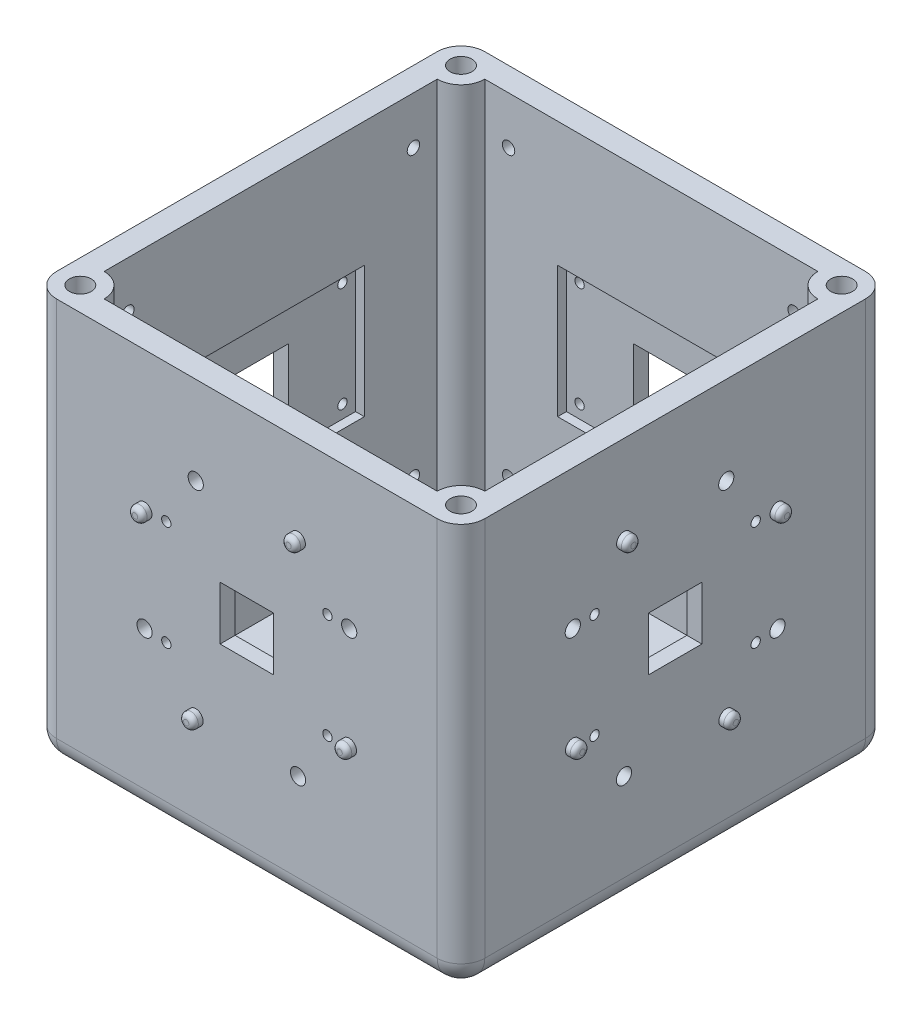
from build123d import *

# Parameters (mm, degrees)
SKETCH1_W                                  = 114.3
SKETCH1_H                                  = 114.3
BOSS_EXTRUDE1_DEPTH                        = 53.975
SHELL1_T                                   = -6.35
SKETCH3_W                                  = 6.35
SKETCH3_H                                  = 101.6
REVOLVE1_ANGLE                             = 90
MIRROR1_AT_THE_SECOND_PLANE_COPY_1_SKETC_W = 6.35
MIRROR1_AT_THE_SECOND_PLANE_COPY_1_SKETC_H = 101.6
MIRROR1_AT_THE_SECOND_PLANE_COPY_1_ANGLE   = 90
SKETCH16_W                                 = 14.2875
SKETCH16_H                                 = 14.2875
CUT_EXTRUDE1_DEPTH                         = 4
MIRROR4_AT_THE_SECOND_PLANE_COPY_1_SKETC_W = 14.2875
MIRROR4_AT_THE_SECOND_PLANE_COPY_1_SKETC_H = 14.2875
MIRROR4_AT_THE_SECOND_PLANE_COPY_1_DEPTH   = 4
FILLET1_R                                  = 6.35
SKETCH22_R                                 = 2.92
CUT_EXTRUDE5_DEPTH                         = 5.007428571
MIRROR6_AT_THE_SECOND_PLANE_COPY_1_SKETC_R = 2.92
MIRROR6_AT_THE_SECOND_PLANE_COPY_1_DEPTH   = 5.007428571
SKETCH25_R                                 = 1.9685
BOSS_EXTRUDE2_DEPTH                        = 2.54
SKETCH25_3_R                               = 2.032
CUT_EXTRUDE6_DEPTH                         = 3.048
FILLET5_R                                  = 1.27
MIRROR14_AT_THE_SECOND_PLANE_COPY_1_SKET_R = 2.032
MIRROR14_AT_THE_SECOND_PLANE_COPY_1_DEPTH  = 3.048
SKETCH30_R                                 = 4.5
BOSS_EXTRUDE3_DEPTH                        = 6.35
SKETCH31_R                                 = 2.249999945
SKETCH31_R_2                               = 2.2499955
SKETCH31_R_3                               = 2.25
CUT_EXTRUDE8_DEPTH                         = 5.8
SKETCH15_W                                 = 50
SKETCH15_H                                 = 35
CUT_EXTRUDE10_DEPTH                        = 2.35
CUT_EXTRUDE11_REACH                        = 143.872
MIRROR15_AT_THE_SECOND_PLANE_COPY_1_SKET_W = 50
MIRROR15_AT_THE_SECOND_PLANE_COPY_1_SKET_H = 35
MIRROR15_AT_THE_SECOND_PLANE_COPY_1_DEPTH  = 2.35
MIRROR15_AT_THE_SECOND_PLANE_COPY_2_REACH  = 143.872
CUT_EXTRUDE12_DEPTH                        = 3.302
MIRROR16_AT_THE_SECOND_PLANE_COPY_1_DEPTH  = 3.302


# Read off the part's stored shape, not the designer's step: Mirror13
with BuildPart() as part:
    # Sketch1 → Boss-Extrude1 (new, symmetric)
    with BuildSketch(Plane(origin=(0, 0, 0), x_dir=(1, 0, 0), z_dir=(0, 1, 0))):
        Rectangle(SKETCH1_W, SKETCH1_H)
    extrude(amount=BOSS_EXTRUDE1_DEPTH, both=True)

    # Shell1
    shell1_openings = [part.faces().sort_by_distance(p)[0] for p in [
        (0, 53.975, 0),
    ]]
    offset(amount=SHELL1_T, openings=shell1_openings, kind=Kind.INTERSECTION)

    # Sketch3 → Revolve1 (revolve)
    with BuildSketch(Plane(origin=(-50.8, 0, 0), x_dir=(0, 0, -1), z_dir=(1, 0, 0))):
        with Locations((-47.625, 3.175)):
            Rectangle(SKETCH3_W, SKETCH3_H)
    revolve1 = revolve(axis=Axis((-50.8, 53.975, 50.8), (0, -1, 0)), revolution_arc=REVOLVE1_ANGLE)

    # Mirror1: Revolve1 across plane
    add(revolve1.mirror(Plane(origin=(0, 0, 0), x_dir=(0, 0, 1), z_dir=(1, 0, 0))))

    # Mirror1 at the second plane: Revolve1 across plane
    add(revolve1.mirror(Plane.XY))

    # Mirror1 at the second plane copy 1 sketc → Mirror1 at the second plane copy 1 (revolve)
    with BuildSketch(Plane.ZY.offset(-50.8)):
        with Locations((-47.625, 3.175)):
            Rectangle(MIRROR1_AT_THE_SECOND_PLANE_COPY_1_SKETC_W, MIRROR1_AT_THE_SECOND_PLANE_COPY_1_SKETC_H)
    revolve(axis=Axis((50.8, 53.975, -50.8), (0, -1, 0)), revolution_arc=MIRROR1_AT_THE_SECOND_PLANE_COPY_1_ANGLE)

    # Sketch16 → Cut-Extrude1 (cut)
    with BuildSketch(Plane.ZY.offset(57.15)):
        with Locations((0, 3.175)):
            Rectangle(SKETCH16_W, SKETCH16_H)
    cut_extrude1 = extrude(amount=-CUT_EXTRUDE1_DEPTH, mode=Mode.SUBTRACT)

    # Mirror4: Cut-Extrude1 across plane
    add(cut_extrude1.mirror(Plane(origin=(0, 0, 0), x_dir=(0.7071067811865465, 0, 0.7071067811865486), z_dir=(-0.7071067811865488, 0, 0.7071067811865464))), mode=Mode.SUBTRACT)

    # Mirror4 at the second plane: Cut-Extrude1 across plane
    add(cut_extrude1.mirror(Plane(origin=(0, 0, 0), x_dir=(-0.7071067811865465, 0, 0.7071067811865486), z_dir=(0.7071067811865488, 0, 0.7071067811865464))), mode=Mode.SUBTRACT)

    # Mirror4 at the second plane copy 1 sketc → Mirror4 at the second plane copy 1 (cut)
    with BuildSketch(Plane(origin=(57.15, 0, 0), x_dir=(0, 0, -1), z_dir=(1, 0, 0))):
        with Locations((0, 3.175)):
            Rectangle(MIRROR4_AT_THE_SECOND_PLANE_COPY_1_SKETC_W, MIRROR4_AT_THE_SECOND_PLANE_COPY_1_SKETC_H)
    extrude(amount=-MIRROR4_AT_THE_SECOND_PLANE_COPY_1_DEPTH, mode=Mode.SUBTRACT)

    # Fillet1
    fillet1_edges = [part.edges().sort_by_distance(p)[0] for p in [
        (0, -53.975, -57.15),
        (57.15, -53.975, 0),
        (0, -53.975, 57.15),
        (-57.15, -53.975, 0),
        (-57.15, 0, -57.15),
        (57.15, 0, -57.15),
        (57.15, 0, 57.15),
        (-57.15, 0, 57.15),
    ]]
    fillet(fillet1_edges, radius=FILLET1_R)

    # Sketch22 → Cut-Extrude5 (cut)
    with BuildSketch(Plane(origin=(0, 53.975, 0), x_dir=(1, 0, 0), z_dir=(0, 1, 0))):
        with Locations(Location((-50.8, -50.8, 0), (0, 0, 270))):
            Circle(SKETCH22_R)
    cut_extrude5 = extrude(amount=-CUT_EXTRUDE5_DEPTH, mode=Mode.SUBTRACT)

    # Mirror6: Cut-Extrude5 across plane
    add(cut_extrude5.mirror(Plane.XY), mode=Mode.SUBTRACT)

    # Mirror6 at the second plane: Cut-Extrude5 across plane
    add(cut_extrude5.mirror(Plane(origin=(0, 0, 0), x_dir=(0, 0, 1), z_dir=(1, 0, 0))), mode=Mode.SUBTRACT)

    # Mirror6 at the second plane copy 1 sketc → Mirror6 at the second plane copy 1 (cut)
    with BuildSketch(Plane(origin=(0, 53.975, 0), x_dir=(-1, 0, 0), z_dir=(0, 1, 0))):
        with Locations(Location((-50.8, -50.8, 0), (0, 0, 270))):
            Circle(MIRROR6_AT_THE_SECOND_PLANE_COPY_1_SKETC_R)
    extrude(amount=-MIRROR6_AT_THE_SECOND_PLANE_COPY_1_DEPTH, mode=Mode.SUBTRACT)

    # Sketch25 → Boss-Extrude2 (add)
    with BuildSketch(Plane.XY.offset(57.15)):
        with Locations(Location((-27.305, 16.8275, 0), (0, 0, 180))):
            Circle(SKETCH25_R)
        with Locations(Location((13.6525, 30.48, 0), (0, 0, 180))):
            Circle(SKETCH25_R)
        with Locations(Location((27.305, -10.4775, 0), (0, 0, 180))):
            Circle(SKETCH25_R)
        with Locations(Location((-13.6525, -24.13, 0), (0, 0, 180))):
            Circle(SKETCH25_R)
    extrude(amount=BOSS_EXTRUDE2_DEPTH)

    # Sketch25<3> → Cut-Extrude6 (cut)
    with BuildSketch(Plane.XY.offset(57.15)):
        with Locations((-27.305, -10.4775)):
            Circle(SKETCH25_3_R)
        with Locations((-13.6525, 30.48)):
            Circle(SKETCH25_3_R)
        with Locations((27.305, 16.8275)):
            Circle(SKETCH25_3_R)
        with Locations((13.6525, -24.13)):
            Circle(SKETCH25_3_R)
    cut_extrude6 = extrude(amount=-CUT_EXTRUDE6_DEPTH, mode=Mode.SUBTRACT)

    # Fillet5
    fillet5_edges = [part.edges().sort_by_distance(p)[0] for p in [
        (15.621, 30.48, 59.69),
        (29.2735, -10.4775, 59.69),
        (-11.684, -24.13, 59.69),
        (-25.3365, 16.8275, 59.69),
    ]]
    fillet(fillet5_edges, radius=FILLET5_R)

    # Mirror13 outline → Mirror13 (revolve)
    with BuildSketch(Plane(origin=(0, -24.13, 13.6525), x_dir=(0, 1, 0), z_dir=(0, 0, -1))):
        with BuildLine():
            ThreePointArc((0.6985, -59.69), (1.596525612, -59.318025612), (1.9685, -58.42))
            Line((1.9685, -58.42), (1.9685, -57.15))
            Line((1.9685, -57.15), (0, -57.15))
            Line((0, -57.15), (0, -59.69))
            Line((0, -59.69), (0.6985, -59.69))
        make_face()
    revolve(axis=Axis((0, -24.13, 13.6525), (1, 0, 0)))

    # Mirror13 2 outline → Mirror13 2 (revolve)
    with BuildSketch(Plane(origin=(0, -10.4775, -27.305), x_dir=(0, 1, 0), z_dir=(0, 0, -1))):
        with BuildLine():
            Line((0, -57.15), (0, -59.69))
            Line((0, -59.69), (0.6985, -59.69))
            ThreePointArc((0.6985, -59.69), (1.596525612, -59.318025612), (1.9685, -58.42))
            Line((1.9685, -58.42), (1.9685, -57.15))
            Line((1.9685, -57.15), (0, -57.15))
        make_face()
    revolve(axis=Axis((0, -10.4775, -27.305), (1, 0, 0)))

    # Mirror13 3 outline → Mirror13 3 (revolve)
    with BuildSketch(Plane(origin=(0, 30.48, -13.6525), x_dir=(0, 1, 0), z_dir=(0, 0, -1))):
        with BuildLine():
            Line((0, -57.15), (0, -59.69))
            Line((0, -59.69), (0.6985, -59.69))
            ThreePointArc((0.6985, -59.69), (1.596525612, -59.318025612), (1.9685, -58.42))
            Line((1.9685, -58.42), (1.9685, -57.15))
            Line((1.9685, -57.15), (0, -57.15))
        make_face()
    revolve(axis=Axis((0, 30.48, -13.6525), (1, 0, 0)))

    # Mirror13 4 outline → Mirror13 4 (revolve)
    with BuildSketch(Plane(origin=(0, 16.8275, 27.305), x_dir=(0, 1, 0), z_dir=(0, 0, -1))):
        with BuildLine():
            Line((0, -57.15), (0, -59.69))
            Line((0, -59.69), (0.6985, -59.69))
            ThreePointArc((0.6985, -59.69), (1.596525612, -59.318025612), (1.9685, -58.42))
            Line((1.9685, -58.42), (1.9685, -57.15))
            Line((1.9685, -57.15), (0, -57.15))
        make_face()
    revolve(axis=Axis((0, 16.8275, 27.305), (1, 0, 0)))

    # Mirror13 5 outline → Mirror13 5 (revolve)
    with BuildSketch(Plane(origin=(0, -24.13, -13.6525), x_dir=(0, 1, 0), z_dir=(0, 0, -1))):
        with BuildLine():
            Line((1.9685, 57.15), (1.9685, 58.42))
            ThreePointArc((1.9685, 58.42), (1.596525612, 59.318025612), (0.6985, 59.69))
            Line((0.6985, 59.69), (0, 59.69))
            Line((0, 59.69), (0, 57.15))
            Line((0, 57.15), (1.9685, 57.15))
        make_face()
    revolve(axis=Axis((0, -24.13, -13.6525), (1, 0, 0)))

    # Mirror13 6 outline → Mirror13 6 (revolve)
    with BuildSketch(Plane(origin=(0, -10.4775, 27.305), x_dir=(0, 1, 0), z_dir=(0, 0, -1))):
        with BuildLine():
            Line((0.6985, 59.69), (0, 59.69))
            Line((0, 59.69), (0, 57.15))
            Line((0, 57.15), (1.9685, 57.15))
            Line((1.9685, 57.15), (1.9685, 58.42))
            ThreePointArc((1.9685, 58.42), (1.596525612, 59.318025612), (0.6985, 59.69))
        make_face()
    revolve(axis=Axis((0, -10.4775, 27.305), (1, 0, 0)))

    # Mirror13 7 outline → Mirror13 7 (revolve)
    with BuildSketch(Plane(origin=(0, 30.48, 13.6525), x_dir=(0, 1, 0), z_dir=(0, 0, -1))):
        with BuildLine():
            Line((0.6985, 59.69), (0, 59.69))
            Line((0, 59.69), (0, 57.15))
            Line((0, 57.15), (1.9685, 57.15))
            Line((1.9685, 57.15), (1.9685, 58.42))
            ThreePointArc((1.9685, 58.42), (1.596525612, 59.318025612), (0.6985, 59.69))
        make_face()
    revolve(axis=Axis((0, 30.48, 13.6525), (1, 0, 0)))

    # Mirror13 8 outline → Mirror13 8 (revolve)
    with BuildSketch(Plane(origin=(0, 16.8275, -27.305), x_dir=(0, 1, 0), z_dir=(0, 0, -1))):
        with BuildLine():
            Line((0.6985, 59.69), (0, 59.69))
            Line((0, 59.69), (0, 57.15))
            Line((0, 57.15), (1.9685, 57.15))
            Line((1.9685, 57.15), (1.9685, 58.42))
            ThreePointArc((1.9685, 58.42), (1.596525612, 59.318025612), (0.6985, 59.69))
        make_face()
    revolve(axis=Axis((0, 16.8275, -27.305), (1, 0, 0)))

    # Mirror13 9 outline → Mirror13 9 (revolve)
    with BuildSketch(Plane(origin=(13.6525, -24.13, 0), x_dir=(1, 0, 0), z_dir=(0, -1, 0))):
        with BuildLine():
            ThreePointArc((0.6985, -59.69), (1.596525612, -59.318025612), (1.9685, -58.42))
            Line((1.9685, -58.42), (1.9685, -57.15))
            Line((1.9685, -57.15), (0, -57.15))
            Line((0, -57.15), (0, -59.69))
            Line((0, -59.69), (0.6985, -59.69))
        make_face()
    revolve(axis=Axis((13.6525, -24.13, 0), (0, 0, 1)))

    # Mirror13 10 outline → Mirror13 10 (revolve)
    with BuildSketch(Plane(origin=(-27.305, -10.4775, 0), x_dir=(1, 0, 0), z_dir=(0, -1, 0))):
        with BuildLine():
            Line((0, -57.15), (0, -59.69))
            Line((0, -59.69), (0.6985, -59.69))
            ThreePointArc((0.6985, -59.69), (1.596525612, -59.318025612), (1.9685, -58.42))
            Line((1.9685, -58.42), (1.9685, -57.15))
            Line((1.9685, -57.15), (0, -57.15))
        make_face()
    revolve(axis=Axis((-27.305, -10.4775, 0), (0, 0, 1)))

    # Mirror13 11 outline → Mirror13 11 (revolve)
    with BuildSketch(Plane(origin=(-13.6525, 30.48, 0), x_dir=(1, 0, 0), z_dir=(0, -1, 0))):
        with BuildLine():
            Line((0, -57.15), (0, -59.69))
            Line((0, -59.69), (0.6985, -59.69))
            ThreePointArc((0.6985, -59.69), (1.596525612, -59.318025612), (1.9685, -58.42))
            Line((1.9685, -58.42), (1.9685, -57.15))
            Line((1.9685, -57.15), (0, -57.15))
        make_face()
    revolve(axis=Axis((-13.6525, 30.48, 0), (0, 0, 1)))

    # Mirror13 12 outline → Mirror13 12 (revolve)
    with BuildSketch(Plane(origin=(27.305, 16.8275, 0), x_dir=(1, 0, 0), z_dir=(0, -1, 0))):
        with BuildLine():
            Line((0, -57.15), (0, -59.69))
            Line((0, -59.69), (0.6985, -59.69))
            ThreePointArc((0.6985, -59.69), (1.596525612, -59.318025612), (1.9685, -58.42))
            Line((1.9685, -58.42), (1.9685, -57.15))
            Line((1.9685, -57.15), (0, -57.15))
        make_face()
    revolve(axis=Axis((27.305, 16.8275, 0), (0, 0, 1)))

    # Mirror14: Cut-Extrude6 across plane
    add(cut_extrude6.mirror(Plane(origin=(0, 0, 0), x_dir=(0.7071067811865465, 0, 0.7071067811865486), z_dir=(-0.7071067811865488, 0, 0.7071067811865464))), mode=Mode.SUBTRACT)

    # Mirror14 at the second plane: Cut-Extrude6 across plane
    add(cut_extrude6.mirror(Plane(origin=(0, 0, 0), x_dir=(-0.7071067811865465, 0, 0.7071067811865486), z_dir=(0.7071067811865488, 0, 0.7071067811865464))), mode=Mode.SUBTRACT)

    # Mirror14 at the second plane copy 1 sket → Mirror14 at the second plane copy 1 (cut)
    with BuildSketch(Plane(origin=(0, 0, -57.15), x_dir=(-1, 0, 0), z_dir=(0, 0, -1))):
        with Locations((-27.305, -10.4775)):
            Circle(MIRROR14_AT_THE_SECOND_PLANE_COPY_1_SKET_R)
        with Locations((-13.6525, 30.48)):
            Circle(MIRROR14_AT_THE_SECOND_PLANE_COPY_1_SKET_R)
        with Locations((27.305, 16.8275)):
            Circle(MIRROR14_AT_THE_SECOND_PLANE_COPY_1_SKET_R)
        with Locations((13.6525, -24.13)):
            Circle(MIRROR14_AT_THE_SECOND_PLANE_COPY_1_SKET_R)
    extrude(amount=-MIRROR14_AT_THE_SECOND_PLANE_COPY_1_DEPTH, mode=Mode.SUBTRACT)

    # Sketch30 → Boss-Extrude3 (add)
    with BuildSketch(Plane(origin=(0, -47.625, 0), x_dir=(1, 0, 0), z_dir=(0, 1, 0))):
        with Locations(Location((-24.5, 15.5, 0), (0, 0, 270))):
            Circle(SKETCH30_R)
        with Locations(Location((24.5, 15.5, 0), (0, 0, 270))):
            Circle(SKETCH30_R)
        with Locations(Location((24.5, -39, 0), (0, 0, 270))):
            Circle(SKETCH30_R)
        with Locations(Location((-24.5, -39, 0), (0, 0, 270))):
            Circle(SKETCH30_R)
    extrude(amount=BOSS_EXTRUDE3_DEPTH)

    # Sketch31 → Cut-Extrude8 (cut)
    with BuildSketch(Plane(origin=(0, -41.275, 0), x_dir=(1, 0, 0), z_dir=(0, 1, 0))):
        with Locations(Location((-24.5, 15.5, 0), (0, 0, 270))):
            Circle(SKETCH31_R)
        with Locations(Location((24.5, 15.5, 0), (0, 0, 270))):
            Circle(SKETCH31_R_2)
        with Locations(Location((-24.5, -39, 0), (0, 0, 270))):
            Circle(SKETCH31_R_2)
        with Locations(Location((24.5, -39, 0), (0, 0, 270))):
            Circle(SKETCH31_R_3)
    extrude(amount=-CUT_EXTRUDE8_DEPTH, mode=Mode.SUBTRACT)

    # Sketch15 → Cut-Extrude10 (cut)
    with BuildSketch(Plane(origin=(-50.8, 0, 0), x_dir=(0, 0, -1), z_dir=(1, 0, 0))):
        with Locations((0, 3.175)):
            Rectangle(SKETCH15_W, SKETCH15_H)
    cut_extrude10 = extrude(amount=-CUT_EXTRUDE10_DEPTH, mode=Mode.SUBTRACT)

    # Sketch34 → Cut-Extrude11 (cut, up to next)
    with BuildSketch(Plane.ZY.offset(57.15), mode=Mode.PRIVATE) as cut_extrude11_sk1:
        with BuildLine():
            Line((-21.5, 15.925), (-21.5, 17.175))
            Line((-21.5, 17.175), (-20.25, 17.175))
            ThreePointArc((-20.25, 17.175), (-22.383883476, 18.058883476), (-21.5, 15.925))
        make_face()
    cut_extrude11_tool1 = extrude(cut_extrude11_sk1.sketch, amount=-CUT_EXTRUDE11_REACH, mode=Mode.PRIVATE) & part.part
    # Sketch34 → Cut-Extrude11 (cut, up to next)
    with BuildSketch(Plane.ZY.offset(57.15), mode=Mode.PRIVATE) as cut_extrude11_sk2:
        with BuildLine():
            Line((-20.25, 17.175), (-21.5, 17.175))
            Line((-21.5, 17.175), (-21.5, 15.925))
            ThreePointArc((-21.5, 15.925), (-20.616116524, 16.291116524), (-20.25, 17.175))
        make_face()
    cut_extrude11_tool2 = extrude(cut_extrude11_sk2.sketch, amount=-CUT_EXTRUDE11_REACH, mode=Mode.PRIVATE) & part.part
    # Sketch34 → Cut-Extrude11 (cut, up to next)
    with BuildSketch(Plane.ZY.offset(57.15), mode=Mode.PRIVATE) as cut_extrude11_sk3:
        with BuildLine():
            Line((-21.5, 15.925), (-21.5, 17.175))
            Line((-21.5, 17.175), (-20.25, 17.175))
            ThreePointArc((-20.25, 17.175), (-22.383883476, 18.058883476), (-21.5, 15.925))
        make_face()
    cut_extrude11_tool3 = extrude(cut_extrude11_sk3.sketch, amount=-CUT_EXTRUDE11_REACH, mode=Mode.PRIVATE) & part.part
    # Sketch34 → Cut-Extrude11 (cut, up to next)
    with BuildSketch(Plane.ZY.offset(57.15), mode=Mode.PRIVATE) as cut_extrude11_sk4:
        with BuildLine():
            Line((-20.25, 17.175), (-21.5, 17.175))
            Line((-21.5, 17.175), (-21.5, 15.925))
            ThreePointArc((-21.5, 15.925), (-20.616116524, 16.291116524), (-20.25, 17.175))
        make_face()
    cut_extrude11_tool4 = extrude(cut_extrude11_sk4.sketch, amount=-CUT_EXTRUDE11_REACH, mode=Mode.PRIVATE) & part.part
    # Sketch34 → Cut-Extrude11 (cut, up to next)
    with BuildSketch(Plane.ZY.offset(57.15), mode=Mode.PRIVATE) as cut_extrude11_sk5:
        with BuildLine():
            ThreePointArc((22.75, 17.175), (21.5, 18.425), (20.25, 17.175))
            Line((20.25, 17.175), (21.5, 17.175))
            Line((21.5, 17.175), (21.5, 15.925))
            ThreePointArc((21.5, 15.925), (22.383883476, 16.291116524), (22.75, 17.175))
        make_face()
    cut_extrude11_tool5 = extrude(cut_extrude11_sk5.sketch, amount=-CUT_EXTRUDE11_REACH, mode=Mode.PRIVATE) & part.part
    # Sketch34 → Cut-Extrude11 (cut, up to next)
    with BuildSketch(Plane.ZY.offset(57.15), mode=Mode.PRIVATE) as cut_extrude11_sk6:
        with BuildLine():
            Line((21.5, 17.175), (20.25, 17.175))
            ThreePointArc((20.25, 17.175), (20.616116524, 16.291116524), (21.5, 15.925))
            Line((21.5, 15.925), (21.5, 17.175))
        make_face()
    cut_extrude11_tool6 = extrude(cut_extrude11_sk6.sketch, amount=-CUT_EXTRUDE11_REACH, mode=Mode.PRIVATE) & part.part
    # Sketch34 → Cut-Extrude11 (cut, up to next)
    with BuildSketch(Plane.ZY.offset(57.15), mode=Mode.PRIVATE) as cut_extrude11_sk7:
        with BuildLine():
            ThreePointArc((22.75, 17.175), (21.5, 18.425), (20.25, 17.175))
            Line((20.25, 17.175), (21.5, 17.175))
            Line((21.5, 17.175), (21.5, 15.925))
            ThreePointArc((21.5, 15.925), (22.383883476, 16.291116524), (22.75, 17.175))
        make_face()
    cut_extrude11_tool7 = extrude(cut_extrude11_sk7.sketch, amount=-CUT_EXTRUDE11_REACH, mode=Mode.PRIVATE) & part.part
    # Sketch34 → Cut-Extrude11 (cut, up to next)
    with BuildSketch(Plane.ZY.offset(57.15), mode=Mode.PRIVATE) as cut_extrude11_sk8:
        with BuildLine():
            Line((21.5, 17.175), (20.25, 17.175))
            ThreePointArc((20.25, 17.175), (20.616116524, 16.291116524), (21.5, 15.925))
            Line((21.5, 15.925), (21.5, 17.175))
        make_face()
    cut_extrude11_tool8 = extrude(cut_extrude11_sk8.sketch, amount=-CUT_EXTRUDE11_REACH, mode=Mode.PRIVATE) & part.part
    # Sketch34 → Cut-Extrude11 (cut, up to next)
    with BuildSketch(Plane.ZY.offset(57.15), mode=Mode.PRIVATE) as cut_extrude11_sk9:
        with BuildLine():
            ThreePointArc((22.75, -10.825), (22.383883476, -9.941116524), (21.5, -9.575))
            Line((21.5, -9.575), (21.5, -10.825))
            Line((21.5, -10.825), (20.25, -10.825))
            ThreePointArc((20.25, -10.825), (21.5, -12.075), (22.75, -10.825))
        make_face()
    cut_extrude11_tool9 = extrude(cut_extrude11_sk9.sketch, amount=-CUT_EXTRUDE11_REACH, mode=Mode.PRIVATE) & part.part
    # Sketch34 → Cut-Extrude11 (cut, up to next)
    with BuildSketch(Plane.ZY.offset(57.15), mode=Mode.PRIVATE) as cut_extrude11_sk10:
        with BuildLine():
            Line((21.5, -10.825), (21.5, -9.575))
            ThreePointArc((21.5, -9.575), (20.616116524, -9.941116524), (20.25, -10.825))
            Line((20.25, -10.825), (21.5, -10.825))
        make_face()
    cut_extrude11_tool10 = extrude(cut_extrude11_sk10.sketch, amount=-CUT_EXTRUDE11_REACH, mode=Mode.PRIVATE) & part.part
    # Sketch34 → Cut-Extrude11 (cut, up to next)
    with BuildSketch(Plane.ZY.offset(57.15), mode=Mode.PRIVATE) as cut_extrude11_sk11:
        with BuildLine():
            ThreePointArc((22.75, -10.825), (22.383883476, -9.941116524), (21.5, -9.575))
            Line((21.5, -9.575), (21.5, -10.825))
            Line((21.5, -10.825), (20.25, -10.825))
            ThreePointArc((20.25, -10.825), (21.5, -12.075), (22.75, -10.825))
        make_face()
    cut_extrude11_tool11 = extrude(cut_extrude11_sk11.sketch, amount=-CUT_EXTRUDE11_REACH, mode=Mode.PRIVATE) & part.part
    # Sketch34 → Cut-Extrude11 (cut, up to next)
    with BuildSketch(Plane.ZY.offset(57.15), mode=Mode.PRIVATE) as cut_extrude11_sk12:
        with BuildLine():
            Line((21.5, -10.825), (21.5, -9.575))
            ThreePointArc((21.5, -9.575), (20.616116524, -9.941116524), (20.25, -10.825))
            Line((20.25, -10.825), (21.5, -10.825))
        make_face()
    cut_extrude11_tool12 = extrude(cut_extrude11_sk12.sketch, amount=-CUT_EXTRUDE11_REACH, mode=Mode.PRIVATE) & part.part
    # Sketch34 → Cut-Extrude11 (cut, up to next)
    with BuildSketch(Plane.ZY.offset(57.15), mode=Mode.PRIVATE) as cut_extrude11_sk13:
        with BuildLine():
            ThreePointArc((-20.25, -10.825), (-20.616116524, -9.941116524), (-21.5, -9.575))
            Line((-21.5, -9.575), (-21.5, -10.825))
            Line((-21.5, -10.825), (-20.25, -10.825))
        make_face()
    cut_extrude11_tool13 = extrude(cut_extrude11_sk13.sketch, amount=-CUT_EXTRUDE11_REACH, mode=Mode.PRIVATE) & part.part
    # Sketch34 → Cut-Extrude11 (cut, up to next)
    with BuildSketch(Plane.ZY.offset(57.15), mode=Mode.PRIVATE) as cut_extrude11_sk14:
        with BuildLine():
            Line((-21.5, -10.825), (-21.5, -9.575))
            ThreePointArc((-21.5, -9.575), (-22.383883476, -11.708883476), (-20.25, -10.825))
            Line((-20.25, -10.825), (-21.5, -10.825))
        make_face()
    cut_extrude11_tool14 = extrude(cut_extrude11_sk14.sketch, amount=-CUT_EXTRUDE11_REACH, mode=Mode.PRIVATE) & part.part
    # Sketch34 → Cut-Extrude11 (cut, up to next)
    with BuildSketch(Plane.ZY.offset(57.15), mode=Mode.PRIVATE) as cut_extrude11_sk15:
        with BuildLine():
            ThreePointArc((-20.25, -10.825), (-20.616116524, -9.941116524), (-21.5, -9.575))
            Line((-21.5, -9.575), (-21.5, -10.825))
            Line((-21.5, -10.825), (-20.25, -10.825))
        make_face()
    cut_extrude11_tool15 = extrude(cut_extrude11_sk15.sketch, amount=-CUT_EXTRUDE11_REACH, mode=Mode.PRIVATE) & part.part
    # Sketch34 → Cut-Extrude11 (cut, up to next)
    with BuildSketch(Plane.ZY.offset(57.15), mode=Mode.PRIVATE) as cut_extrude11_sk16:
        with BuildLine():
            Line((-21.5, -10.825), (-21.5, -9.575))
            ThreePointArc((-21.5, -9.575), (-22.383883476, -11.708883476), (-20.25, -10.825))
            Line((-20.25, -10.825), (-21.5, -10.825))
        make_face()
    cut_extrude11_tool16 = extrude(cut_extrude11_sk16.sketch, amount=-CUT_EXTRUDE11_REACH, mode=Mode.PRIVATE) & part.part
    cut_extrude11_1 = cut_extrude11_tool1.solids().sort_by_distance((-57.15, 17.351839, -21.676839))[0]
    add(cut_extrude11_1, mode=Mode.SUBTRACT)
    cut_extrude11_2 = cut_extrude11_tool2.solids().sort_by_distance((-57.15, 16.644484, -20.969484))[0]
    add(cut_extrude11_2, mode=Mode.SUBTRACT)
    cut_extrude11_3 = cut_extrude11_tool3.solids().sort_by_distance((-57.15, 17.351839, -21.676839))[0]
    add(cut_extrude11_3, mode=Mode.SUBTRACT)
    cut_extrude11_4 = cut_extrude11_tool4.solids().sort_by_distance((-57.15, 16.644484, -20.969484))[0]
    add(cut_extrude11_4, mode=Mode.SUBTRACT)
    cut_extrude11_5 = cut_extrude11_tool5.solids().sort_by_distance((-57.15, 17.351839, 21.676839))[0]
    add(cut_extrude11_5, mode=Mode.SUBTRACT)
    cut_extrude11_6 = cut_extrude11_tool6.solids().sort_by_distance((-57.15, 16.644484, 20.969484))[0]
    add(cut_extrude11_6, mode=Mode.SUBTRACT)
    cut_extrude11_7 = cut_extrude11_tool7.solids().sort_by_distance((-57.15, 17.351839, 21.676839))[0]
    add(cut_extrude11_7, mode=Mode.SUBTRACT)
    cut_extrude11_8 = cut_extrude11_tool8.solids().sort_by_distance((-57.15, 16.644484, 20.969484))[0]
    add(cut_extrude11_8, mode=Mode.SUBTRACT)
    cut_extrude11_9 = cut_extrude11_tool9.solids().sort_by_distance((-57.15, -11.001839, 21.676839))[0]
    add(cut_extrude11_9, mode=Mode.SUBTRACT)
    cut_extrude11_10 = cut_extrude11_tool10.solids().sort_by_distance((-57.15, -10.294484, 20.969484))[0]
    add(cut_extrude11_10, mode=Mode.SUBTRACT)
    cut_extrude11_11 = cut_extrude11_tool11.solids().sort_by_distance((-57.15, -11.001839, 21.676839))[0]
    add(cut_extrude11_11, mode=Mode.SUBTRACT)
    cut_extrude11_12 = cut_extrude11_tool12.solids().sort_by_distance((-57.15, -10.294484, 20.969484))[0]
    add(cut_extrude11_12, mode=Mode.SUBTRACT)
    cut_extrude11_13 = cut_extrude11_tool13.solids().sort_by_distance((-57.15, -10.294484, -20.969484))[0]
    add(cut_extrude11_13, mode=Mode.SUBTRACT)
    cut_extrude11_14 = cut_extrude11_tool14.solids().sort_by_distance((-57.15, -11.001839, -21.676839))[0]
    add(cut_extrude11_14, mode=Mode.SUBTRACT)
    cut_extrude11_15 = cut_extrude11_tool15.solids().sort_by_distance((-57.15, -10.294484, -20.969484))[0]
    add(cut_extrude11_15, mode=Mode.SUBTRACT)
    cut_extrude11_16 = cut_extrude11_tool16.solids().sort_by_distance((-57.15, -11.001839, -21.676839))[0]
    add(cut_extrude11_16, mode=Mode.SUBTRACT)
    cut_extrude11 = cut_extrude11_1 + cut_extrude11_2 + cut_extrude11_3 + cut_extrude11_4 + cut_extrude11_5 + cut_extrude11_6 + cut_extrude11_7 + cut_extrude11_8 + cut_extrude11_9 + cut_extrude11_10 + cut_extrude11_11 + cut_extrude11_12 + cut_extrude11_13 + cut_extrude11_14 + cut_extrude11_15 + cut_extrude11_16  # Cut-Extrude11 as one shape, for the pattern or mirror that repeats it

    # Mirror15: Cut-Extrude10, Cut-Extrude11 across plane
    add(cut_extrude10.mirror(Plane(origin=(0, 0, 0), x_dir=(0.7071067811865465, 0, 0.7071067811865486), z_dir=(-0.7071067811865488, 0, 0.7071067811865464))), mode=Mode.SUBTRACT)
    add(cut_extrude11.mirror(Plane(origin=(0, 0, 0), x_dir=(0.7071067811865465, 0, 0.7071067811865486), z_dir=(-0.7071067811865488, 0, 0.7071067811865464))), mode=Mode.SUBTRACT)

    # Mirror15 at the second plane: Cut-Extrude10, Cut-Extrude11 across plane
    add(cut_extrude10.mirror(Plane(origin=(0, 0, 0), x_dir=(-0.7071067811865465, 0, 0.7071067811865486), z_dir=(0.7071067811865488, 0, 0.7071067811865464))), mode=Mode.SUBTRACT)
    add(cut_extrude11.mirror(Plane(origin=(0, 0, 0), x_dir=(-0.7071067811865465, 0, 0.7071067811865486), z_dir=(0.7071067811865488, 0, 0.7071067811865464))), mode=Mode.SUBTRACT)

    # Mirror15 at the second plane copy 1 sket → Mirror15 at the second plane copy 1 (cut)
    with BuildSketch(Plane.ZY.offset(-50.8)):
        with Locations((0, 3.175)):
            Rectangle(MIRROR15_AT_THE_SECOND_PLANE_COPY_1_SKET_W, MIRROR15_AT_THE_SECOND_PLANE_COPY_1_SKET_H)
    extrude(amount=-MIRROR15_AT_THE_SECOND_PLANE_COPY_1_DEPTH, mode=Mode.SUBTRACT)

    # Mirror15 at the second plane copy 2 sket → Mirror15 at the second plane copy 2 (cut, up to next)
    with BuildSketch(Plane(origin=(57.15, 0, 0), x_dir=(0, 0, -1), z_dir=(1, 0, 0)), mode=Mode.PRIVATE) as mirror15_at_the_second_plane_copy_2_sk1:
        with BuildLine():
            Line((-21.5, 15.925), (-21.5, 17.175))
            Line((-21.5, 17.175), (-20.25, 17.175))
            ThreePointArc((-20.25, 17.175), (-22.383883476, 18.058883476), (-21.5, 15.925))
        make_face()
    mirror15_at_the_second_plane_copy_2_tool1 = extrude(mirror15_at_the_second_plane_copy_2_sk1.sketch, amount=-MIRROR15_AT_THE_SECOND_PLANE_COPY_2_REACH, mode=Mode.PRIVATE) & part.part
    # Mirror15 at the second plane copy 2 sket → Mirror15 at the second plane copy 2 (cut, up to next)
    with BuildSketch(Plane(origin=(57.15, 0, 0), x_dir=(0, 0, -1), z_dir=(1, 0, 0)), mode=Mode.PRIVATE) as mirror15_at_the_second_plane_copy_2_sk2:
        with BuildLine():
            Line((-20.25, 17.175), (-21.5, 17.175))
            Line((-21.5, 17.175), (-21.5, 15.925))
            ThreePointArc((-21.5, 15.925), (-20.616116524, 16.291116524), (-20.25, 17.175))
        make_face()
    mirror15_at_the_second_plane_copy_2_tool2 = extrude(mirror15_at_the_second_plane_copy_2_sk2.sketch, amount=-MIRROR15_AT_THE_SECOND_PLANE_COPY_2_REACH, mode=Mode.PRIVATE) & part.part
    # Mirror15 at the second plane copy 2 sket → Mirror15 at the second plane copy 2 (cut, up to next)
    with BuildSketch(Plane(origin=(57.15, 0, 0), x_dir=(0, 0, -1), z_dir=(1, 0, 0)), mode=Mode.PRIVATE) as mirror15_at_the_second_plane_copy_2_sk3:
        with BuildLine():
            Line((-21.5, 15.925), (-21.5, 17.175))
            Line((-21.5, 17.175), (-20.25, 17.175))
            ThreePointArc((-20.25, 17.175), (-22.383883476, 18.058883476), (-21.5, 15.925))
        make_face()
    mirror15_at_the_second_plane_copy_2_tool3 = extrude(mirror15_at_the_second_plane_copy_2_sk3.sketch, amount=-MIRROR15_AT_THE_SECOND_PLANE_COPY_2_REACH, mode=Mode.PRIVATE) & part.part
    # Mirror15 at the second plane copy 2 sket → Mirror15 at the second plane copy 2 (cut, up to next)
    with BuildSketch(Plane(origin=(57.15, 0, 0), x_dir=(0, 0, -1), z_dir=(1, 0, 0)), mode=Mode.PRIVATE) as mirror15_at_the_second_plane_copy_2_sk4:
        with BuildLine():
            Line((-20.25, 17.175), (-21.5, 17.175))
            Line((-21.5, 17.175), (-21.5, 15.925))
            ThreePointArc((-21.5, 15.925), (-20.616116524, 16.291116524), (-20.25, 17.175))
        make_face()
    mirror15_at_the_second_plane_copy_2_tool4 = extrude(mirror15_at_the_second_plane_copy_2_sk4.sketch, amount=-MIRROR15_AT_THE_SECOND_PLANE_COPY_2_REACH, mode=Mode.PRIVATE) & part.part
    # Mirror15 at the second plane copy 2 sket → Mirror15 at the second plane copy 2 (cut, up to next)
    with BuildSketch(Plane(origin=(57.15, 0, 0), x_dir=(0, 0, -1), z_dir=(1, 0, 0)), mode=Mode.PRIVATE) as mirror15_at_the_second_plane_copy_2_sk5:
        with BuildLine():
            ThreePointArc((22.75, 17.175), (21.5, 18.425), (20.25, 17.175))
            Line((20.25, 17.175), (21.5, 17.175))
            Line((21.5, 17.175), (21.5, 15.925))
            ThreePointArc((21.5, 15.925), (22.383883476, 16.291116524), (22.75, 17.175))
        make_face()
    mirror15_at_the_second_plane_copy_2_tool5 = extrude(mirror15_at_the_second_plane_copy_2_sk5.sketch, amount=-MIRROR15_AT_THE_SECOND_PLANE_COPY_2_REACH, mode=Mode.PRIVATE) & part.part
    # Mirror15 at the second plane copy 2 sket → Mirror15 at the second plane copy 2 (cut, up to next)
    with BuildSketch(Plane(origin=(57.15, 0, 0), x_dir=(0, 0, -1), z_dir=(1, 0, 0)), mode=Mode.PRIVATE) as mirror15_at_the_second_plane_copy_2_sk6:
        with BuildLine():
            Line((21.5, 17.175), (20.25, 17.175))
            ThreePointArc((20.25, 17.175), (20.616116524, 16.291116524), (21.5, 15.925))
            Line((21.5, 15.925), (21.5, 17.175))
        make_face()
    mirror15_at_the_second_plane_copy_2_tool6 = extrude(mirror15_at_the_second_plane_copy_2_sk6.sketch, amount=-MIRROR15_AT_THE_SECOND_PLANE_COPY_2_REACH, mode=Mode.PRIVATE) & part.part
    # Mirror15 at the second plane copy 2 sket → Mirror15 at the second plane copy 2 (cut, up to next)
    with BuildSketch(Plane(origin=(57.15, 0, 0), x_dir=(0, 0, -1), z_dir=(1, 0, 0)), mode=Mode.PRIVATE) as mirror15_at_the_second_plane_copy_2_sk7:
        with BuildLine():
            ThreePointArc((22.75, 17.175), (21.5, 18.425), (20.25, 17.175))
            Line((20.25, 17.175), (21.5, 17.175))
            Line((21.5, 17.175), (21.5, 15.925))
            ThreePointArc((21.5, 15.925), (22.383883476, 16.291116524), (22.75, 17.175))
        make_face()
    mirror15_at_the_second_plane_copy_2_tool7 = extrude(mirror15_at_the_second_plane_copy_2_sk7.sketch, amount=-MIRROR15_AT_THE_SECOND_PLANE_COPY_2_REACH, mode=Mode.PRIVATE) & part.part
    # Mirror15 at the second plane copy 2 sket → Mirror15 at the second plane copy 2 (cut, up to next)
    with BuildSketch(Plane(origin=(57.15, 0, 0), x_dir=(0, 0, -1), z_dir=(1, 0, 0)), mode=Mode.PRIVATE) as mirror15_at_the_second_plane_copy_2_sk8:
        with BuildLine():
            Line((21.5, 17.175), (20.25, 17.175))
            ThreePointArc((20.25, 17.175), (20.616116524, 16.291116524), (21.5, 15.925))
            Line((21.5, 15.925), (21.5, 17.175))
        make_face()
    mirror15_at_the_second_plane_copy_2_tool8 = extrude(mirror15_at_the_second_plane_copy_2_sk8.sketch, amount=-MIRROR15_AT_THE_SECOND_PLANE_COPY_2_REACH, mode=Mode.PRIVATE) & part.part
    # Mirror15 at the second plane copy 2 sket → Mirror15 at the second plane copy 2 (cut, up to next)
    with BuildSketch(Plane(origin=(57.15, 0, 0), x_dir=(0, 0, -1), z_dir=(1, 0, 0)), mode=Mode.PRIVATE) as mirror15_at_the_second_plane_copy_2_sk9:
        with BuildLine():
            ThreePointArc((22.75, -10.825), (22.383883476, -9.941116524), (21.5, -9.575))
            Line((21.5, -9.575), (21.5, -10.825))
            Line((21.5, -10.825), (20.25, -10.825))
            ThreePointArc((20.25, -10.825), (21.5, -12.075), (22.75, -10.825))
        make_face()
    mirror15_at_the_second_plane_copy_2_tool9 = extrude(mirror15_at_the_second_plane_copy_2_sk9.sketch, amount=-MIRROR15_AT_THE_SECOND_PLANE_COPY_2_REACH, mode=Mode.PRIVATE) & part.part
    # Mirror15 at the second plane copy 2 sket → Mirror15 at the second plane copy 2 (cut, up to next)
    with BuildSketch(Plane(origin=(57.15, 0, 0), x_dir=(0, 0, -1), z_dir=(1, 0, 0)), mode=Mode.PRIVATE) as mirror15_at_the_second_plane_copy_2_sk10:
        with BuildLine():
            Line((21.5, -10.825), (21.5, -9.575))
            ThreePointArc((21.5, -9.575), (20.616116524, -9.941116524), (20.25, -10.825))
            Line((20.25, -10.825), (21.5, -10.825))
        make_face()
    mirror15_at_the_second_plane_copy_2_tool10 = extrude(mirror15_at_the_second_plane_copy_2_sk10.sketch, amount=-MIRROR15_AT_THE_SECOND_PLANE_COPY_2_REACH, mode=Mode.PRIVATE) & part.part
    # Mirror15 at the second plane copy 2 sket → Mirror15 at the second plane copy 2 (cut, up to next)
    with BuildSketch(Plane(origin=(57.15, 0, 0), x_dir=(0, 0, -1), z_dir=(1, 0, 0)), mode=Mode.PRIVATE) as mirror15_at_the_second_plane_copy_2_sk11:
        with BuildLine():
            ThreePointArc((22.75, -10.825), (22.383883476, -9.941116524), (21.5, -9.575))
            Line((21.5, -9.575), (21.5, -10.825))
            Line((21.5, -10.825), (20.25, -10.825))
            ThreePointArc((20.25, -10.825), (21.5, -12.075), (22.75, -10.825))
        make_face()
    mirror15_at_the_second_plane_copy_2_tool11 = extrude(mirror15_at_the_second_plane_copy_2_sk11.sketch, amount=-MIRROR15_AT_THE_SECOND_PLANE_COPY_2_REACH, mode=Mode.PRIVATE) & part.part
    # Mirror15 at the second plane copy 2 sket → Mirror15 at the second plane copy 2 (cut, up to next)
    with BuildSketch(Plane(origin=(57.15, 0, 0), x_dir=(0, 0, -1), z_dir=(1, 0, 0)), mode=Mode.PRIVATE) as mirror15_at_the_second_plane_copy_2_sk12:
        with BuildLine():
            Line((21.5, -10.825), (21.5, -9.575))
            ThreePointArc((21.5, -9.575), (20.616116524, -9.941116524), (20.25, -10.825))
            Line((20.25, -10.825), (21.5, -10.825))
        make_face()
    mirror15_at_the_second_plane_copy_2_tool12 = extrude(mirror15_at_the_second_plane_copy_2_sk12.sketch, amount=-MIRROR15_AT_THE_SECOND_PLANE_COPY_2_REACH, mode=Mode.PRIVATE) & part.part
    # Mirror15 at the second plane copy 2 sket → Mirror15 at the second plane copy 2 (cut, up to next)
    with BuildSketch(Plane(origin=(57.15, 0, 0), x_dir=(0, 0, -1), z_dir=(1, 0, 0)), mode=Mode.PRIVATE) as mirror15_at_the_second_plane_copy_2_sk13:
        with BuildLine():
            ThreePointArc((-20.25, -10.825), (-20.616116524, -9.941116524), (-21.5, -9.575))
            Line((-21.5, -9.575), (-21.5, -10.825))
            Line((-21.5, -10.825), (-20.25, -10.825))
        make_face()
    mirror15_at_the_second_plane_copy_2_tool13 = extrude(mirror15_at_the_second_plane_copy_2_sk13.sketch, amount=-MIRROR15_AT_THE_SECOND_PLANE_COPY_2_REACH, mode=Mode.PRIVATE) & part.part
    # Mirror15 at the second plane copy 2 sket → Mirror15 at the second plane copy 2 (cut, up to next)
    with BuildSketch(Plane(origin=(57.15, 0, 0), x_dir=(0, 0, -1), z_dir=(1, 0, 0)), mode=Mode.PRIVATE) as mirror15_at_the_second_plane_copy_2_sk14:
        with BuildLine():
            Line((-21.5, -10.825), (-21.5, -9.575))
            ThreePointArc((-21.5, -9.575), (-22.383883476, -11.708883476), (-20.25, -10.825))
            Line((-20.25, -10.825), (-21.5, -10.825))
        make_face()
    mirror15_at_the_second_plane_copy_2_tool14 = extrude(mirror15_at_the_second_plane_copy_2_sk14.sketch, amount=-MIRROR15_AT_THE_SECOND_PLANE_COPY_2_REACH, mode=Mode.PRIVATE) & part.part
    # Mirror15 at the second plane copy 2 sket → Mirror15 at the second plane copy 2 (cut, up to next)
    with BuildSketch(Plane(origin=(57.15, 0, 0), x_dir=(0, 0, -1), z_dir=(1, 0, 0)), mode=Mode.PRIVATE) as mirror15_at_the_second_plane_copy_2_sk15:
        with BuildLine():
            ThreePointArc((-20.25, -10.825), (-20.616116524, -9.941116524), (-21.5, -9.575))
            Line((-21.5, -9.575), (-21.5, -10.825))
            Line((-21.5, -10.825), (-20.25, -10.825))
        make_face()
    mirror15_at_the_second_plane_copy_2_tool15 = extrude(mirror15_at_the_second_plane_copy_2_sk15.sketch, amount=-MIRROR15_AT_THE_SECOND_PLANE_COPY_2_REACH, mode=Mode.PRIVATE) & part.part
    # Mirror15 at the second plane copy 2 sket → Mirror15 at the second plane copy 2 (cut, up to next)
    with BuildSketch(Plane(origin=(57.15, 0, 0), x_dir=(0, 0, -1), z_dir=(1, 0, 0)), mode=Mode.PRIVATE) as mirror15_at_the_second_plane_copy_2_sk16:
        with BuildLine():
            Line((-21.5, -10.825), (-21.5, -9.575))
            ThreePointArc((-21.5, -9.575), (-22.383883476, -11.708883476), (-20.25, -10.825))
            Line((-20.25, -10.825), (-21.5, -10.825))
        make_face()
    mirror15_at_the_second_plane_copy_2_tool16 = extrude(mirror15_at_the_second_plane_copy_2_sk16.sketch, amount=-MIRROR15_AT_THE_SECOND_PLANE_COPY_2_REACH, mode=Mode.PRIVATE) & part.part
    add(mirror15_at_the_second_plane_copy_2_tool1.solids().sort_by_distance((57.15, 17.351839, 21.676839))[0], mode=Mode.SUBTRACT)
    add(mirror15_at_the_second_plane_copy_2_tool2.solids().sort_by_distance((57.15, 16.644484, 20.969484))[0], mode=Mode.SUBTRACT)
    add(mirror15_at_the_second_plane_copy_2_tool3.solids().sort_by_distance((57.15, 17.351839, 21.676839))[0], mode=Mode.SUBTRACT)
    add(mirror15_at_the_second_plane_copy_2_tool4.solids().sort_by_distance((57.15, 16.644484, 20.969484))[0], mode=Mode.SUBTRACT)
    add(mirror15_at_the_second_plane_copy_2_tool5.solids().sort_by_distance((57.15, 17.351839, -21.676839))[0], mode=Mode.SUBTRACT)
    add(mirror15_at_the_second_plane_copy_2_tool6.solids().sort_by_distance((57.15, 16.644484, -20.969484))[0], mode=Mode.SUBTRACT)
    add(mirror15_at_the_second_plane_copy_2_tool7.solids().sort_by_distance((57.15, 17.351839, -21.676839))[0], mode=Mode.SUBTRACT)
    add(mirror15_at_the_second_plane_copy_2_tool8.solids().sort_by_distance((57.15, 16.644484, -20.969484))[0], mode=Mode.SUBTRACT)
    add(mirror15_at_the_second_plane_copy_2_tool9.solids().sort_by_distance((57.15, -11.001839, -21.676839))[0], mode=Mode.SUBTRACT)
    add(mirror15_at_the_second_plane_copy_2_tool10.solids().sort_by_distance((57.15, -10.294484, -20.969484))[0], mode=Mode.SUBTRACT)
    add(mirror15_at_the_second_plane_copy_2_tool11.solids().sort_by_distance((57.15, -11.001839, -21.676839))[0], mode=Mode.SUBTRACT)
    add(mirror15_at_the_second_plane_copy_2_tool12.solids().sort_by_distance((57.15, -10.294484, -20.969484))[0], mode=Mode.SUBTRACT)
    add(mirror15_at_the_second_plane_copy_2_tool13.solids().sort_by_distance((57.15, -10.294484, 20.969484))[0], mode=Mode.SUBTRACT)
    add(mirror15_at_the_second_plane_copy_2_tool14.solids().sort_by_distance((57.15, -11.001839, 21.676839))[0], mode=Mode.SUBTRACT)
    add(mirror15_at_the_second_plane_copy_2_tool15.solids().sort_by_distance((57.15, -10.294484, 20.969484))[0], mode=Mode.SUBTRACT)
    add(mirror15_at_the_second_plane_copy_2_tool16.solids().sort_by_distance((57.15, -11.001839, 21.676839))[0], mode=Mode.SUBTRACT)

    # Sketch35 → Cut-Extrude12 (cut)
    with BuildSketch(Plane.ZY.offset(-50.8)):
        with BuildLine():
            Line((-38.1, 39.624), (-38.1, 41.275))
            Line((-38.1, 41.275), (-36.449, 41.275))
            ThreePointArc((-36.449, 41.275), (-39.267433296, 42.442433296), (-38.1, 39.624))
        make_face()
        with BuildLine():
            Line((-36.449, 41.275), (-38.1, 41.275))
            Line((-38.1, 41.275), (-38.1, 39.624))
            ThreePointArc((-38.1, 39.624), (-36.932566704, 40.107566704), (-36.449, 41.275))
        make_face()
        with BuildLine():
            ThreePointArc((39.751, 41.275), (38.1, 42.926), (36.449, 41.275))
            Line((36.449, 41.275), (38.1, 41.275))
            Line((38.1, 41.275), (38.1, 39.624))
            ThreePointArc((38.1, 39.624), (39.267433296, 40.107566704), (39.751, 41.275))
        make_face()
        with BuildLine():
            Line((38.1, 41.275), (36.449, 41.275))
            ThreePointArc((36.449, 41.275), (36.932566704, 40.107566704), (38.1, 39.624))
            Line((38.1, 39.624), (38.1, 41.275))
        make_face()
        with BuildLine():
            ThreePointArc((39.751, -34.925), (39.267433296, -33.757566704), (38.1, -33.274))
            Line((38.1, -33.274), (38.1, -34.925))
            Line((38.1, -34.925), (36.449, -34.925))
            ThreePointArc((36.449, -34.925), (38.1, -36.576), (39.751, -34.925))
        make_face()
        with BuildLine():
            Line((38.1, -34.925), (38.1, -33.274))
            ThreePointArc((38.1, -33.274), (36.932566704, -33.757566704), (36.449, -34.925))
            Line((36.449, -34.925), (38.1, -34.925))
        make_face()
        with BuildLine():
            ThreePointArc((-36.449, -34.925), (-36.932566704, -33.757566704), (-38.1, -33.274))
            Line((-38.1, -33.274), (-38.1, -34.925))
            Line((-38.1, -34.925), (-36.449, -34.925))
        make_face()
        with BuildLine():
            Line((-38.1, -34.925), (-38.1, -33.274))
            ThreePointArc((-38.1, -33.274), (-39.267433296, -36.092433296), (-36.449, -34.925))
            Line((-36.449, -34.925), (-38.1, -34.925))
        make_face()
    cut_extrude12 = extrude(amount=-CUT_EXTRUDE12_DEPTH, mode=Mode.SUBTRACT)

    # Mirror16: Cut-Extrude12 across plane
    add(cut_extrude12.mirror(Plane(origin=(0, 0, 0), x_dir=(0.7071067811865465, 0, 0.7071067811865486), z_dir=(-0.7071067811865488, 0, 0.7071067811865464))), mode=Mode.SUBTRACT)

    # Mirror16 at the second plane: Cut-Extrude12 across plane
    add(cut_extrude12.mirror(Plane(origin=(0, 0, 0), x_dir=(-0.7071067811865465, 0, 0.7071067811865486), z_dir=(0.7071067811865488, 0, 0.7071067811865464))), mode=Mode.SUBTRACT)

    # Mirror16 at the second plane copy 1 sket → Mirror16 at the second plane copy 1 (cut)
    with BuildSketch(Plane(origin=(-50.8, 0, 0), x_dir=(0, 0, -1), z_dir=(1, 0, 0))):
        with BuildLine():
            Line((-38.1, 39.624), (-38.1, 41.275))
            Line((-38.1, 41.275), (-36.449, 41.275))
            ThreePointArc((-36.449, 41.275), (-39.267433296, 42.442433296), (-38.1, 39.624))
        make_face()
        with BuildLine():
            Line((-36.449, 41.275), (-38.1, 41.275))
            Line((-38.1, 41.275), (-38.1, 39.624))
            ThreePointArc((-38.1, 39.624), (-36.932566704, 40.107566704), (-36.449, 41.275))
        make_face()
        with BuildLine():
            ThreePointArc((39.751, 41.275), (38.1, 42.926), (36.449, 41.275))
            Line((36.449, 41.275), (38.1, 41.275))
            Line((38.1, 41.275), (38.1, 39.624))
            ThreePointArc((38.1, 39.624), (39.267433296, 40.107566704), (39.751, 41.275))
        make_face()
        with BuildLine():
            Line((38.1, 41.275), (36.449, 41.275))
            ThreePointArc((36.449, 41.275), (36.932566704, 40.107566704), (38.1, 39.624))
            Line((38.1, 39.624), (38.1, 41.275))
        make_face()
        with BuildLine():
            ThreePointArc((39.751, -34.925), (39.267433296, -33.757566704), (38.1, -33.274))
            Line((38.1, -33.274), (38.1, -34.925))
            Line((38.1, -34.925), (36.449, -34.925))
            ThreePointArc((36.449, -34.925), (38.1, -36.576), (39.751, -34.925))
        make_face()
        with BuildLine():
            Line((38.1, -34.925), (38.1, -33.274))
            ThreePointArc((38.1, -33.274), (36.932566704, -33.757566704), (36.449, -34.925))
            Line((36.449, -34.925), (38.1, -34.925))
        make_face()
        with BuildLine():
            ThreePointArc((-36.449, -34.925), (-36.932566704, -33.757566704), (-38.1, -33.274))
            Line((-38.1, -33.274), (-38.1, -34.925))
            Line((-38.1, -34.925), (-36.449, -34.925))
        make_face()
        with BuildLine():
            Line((-38.1, -34.925), (-38.1, -33.274))
            ThreePointArc((-38.1, -33.274), (-39.267433296, -36.092433296), (-36.449, -34.925))
            Line((-36.449, -34.925), (-38.1, -34.925))
        make_face()
    extrude(amount=-MIRROR16_AT_THE_SECOND_PLANE_COPY_1_DEPTH, mode=Mode.SUBTRACT)


solid = part.part
